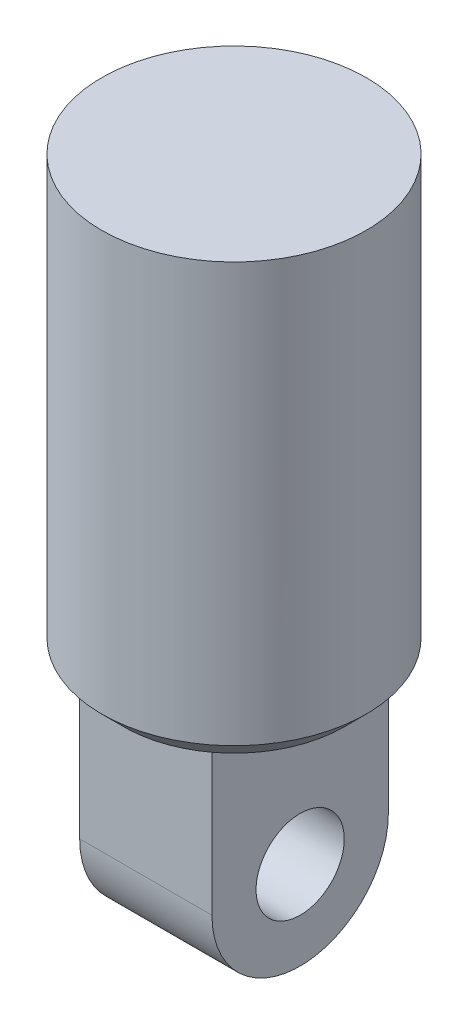
from build123d import *

# Parameters (mm, degrees)
SKETCH1_W           = 30
SKETCH1_H           = 100
SKETCH2_R           = 10
BOSS_EXTRUDE1_DEPTH = 15
CHAMFER1_SIZE       = 5


with BuildPart() as part:
    # Sketch1 → Revolve1 (revolve)
    with BuildSketch(Plane.XY, mode=Mode.PRIVATE) as revolve1_sk:
        with Locations((15, -50)):
            Rectangle(SKETCH1_W, SKETCH1_H)
    revolve(revolve1_sk.sketch.rotate(Axis((0, 0, 0), (0, 1, 0)), 90), axis=Axis((0, 0, 0), (0, 1, 0)))

    # Sketch2 → Boss-Extrude1 (add, symmetric)
    with BuildSketch(Plane(origin=(0, 0, 0), x_dir=(0, 0, -1), z_dir=(1, 0, 0))):
        with BuildLine():
            Line((-20, -132), (-20, -100))
            Line((-20, -100), (20, -100))
            Line((20, -100), (20, -132))
            ThreePointArc((20, -132), (0, -152), (-20, -132))
        make_face()
        with Locations((0, -132)):
            Circle(SKETCH2_R, mode=Mode.SUBTRACT)
    extrude(amount=BOSS_EXTRUDE1_DEPTH, both=True)

    # Chamfer1
    chamfer1_edges = [part.edges().sort_by_distance(p)[0] for p in [
        (0, -100, 30),
    ]]
    chamfer(chamfer1_edges, length=CHAMFER1_SIZE - 0.0001)  # a hair under: the kernel refuses the full size


solid = part.part
